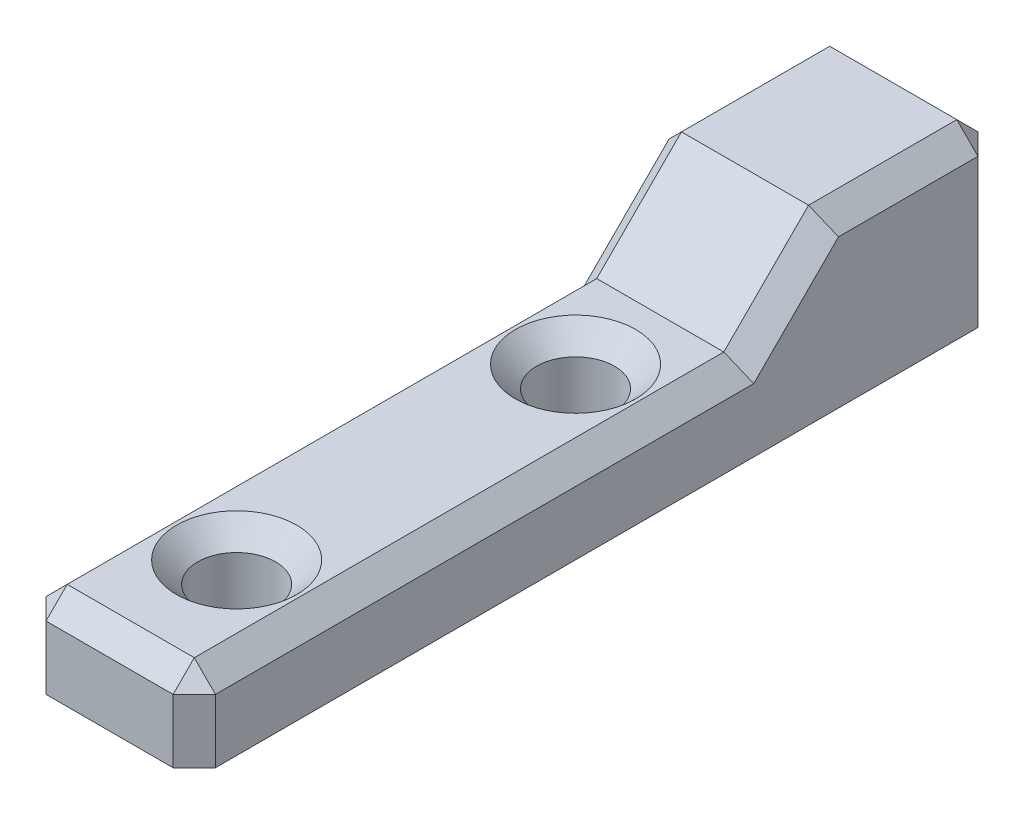
from build123d import *

# Parameters (mm, degrees)
SKETCH1_W           = 12.7
SKETCH1_H           = 60.325
SKETCH1_R           = 2.921
BOSS_EXTRUDE1_DEPTH = 12.7
SKETCH2_W           = 47.625
SKETCH2_H           = 6.35
CUT_EXTRUDE1_DEPTH  = 63.941922635
CHAMFER1_SIZE       = 6.35


# Some blends are built 0.0001 mm under size
with BuildPart() as part:
    # Sketch1 → Boss-Extrude1 (new body)
    with BuildSketch(Plane(origin=(0, 0, 0), x_dir=(1, 0, 0), z_dir=(0, 1, 0))):
        with Locations((6.35, 30.1625)):
            Rectangle(SKETCH1_W, SKETCH1_H)
        with Locations(Location((6.35, 9.525, 0), (0, 0, 270))):
            Circle(SKETCH1_R, mode=Mode.SUBTRACT)
        with Locations(Location((6.35, 34.925, 0), (0, 0, 270))):
            Circle(SKETCH1_R, mode=Mode.SUBTRACT)
    extrude(amount=BOSS_EXTRUDE1_DEPTH)

    # Sketch2 → Cut-Extrude1 (cut, through all)
    with BuildSketch(Plane(origin=(12.7, 0, 0), x_dir=(0, 0, -1), z_dir=(1, 0, 0))):
        with Locations((23.8125, 9.525)):
            Rectangle(SKETCH2_W, SKETCH2_H)
    extrude(amount=-CUT_EXTRUDE1_DEPTH, mode=Mode.SUBTRACT)

    # Chamfer1
    chamfer1_edges = [part.edges().sort_by_distance(p)[0] for p in [
        (6.35, 6.35, -47.625),
    ]]
    chamfer(chamfer1_edges, length=CHAMFER1_SIZE - 0.0001)  # a hair under: the kernel refuses the full size

    # Chamfer2
    # the kernel refuses this chamfer: 1.5875 mm, written as the material it takes off along each edge
    with BuildSketch(Plane(origin=(11.641666667, 11.641666667, -59.266666667), x_dir=(-0.7071067811865476, 0.7071067811865476, 0), z_dir=(0.5773502691896255, 0.5773502691896255, -0.5773502691896263)), Plane(origin=(1.058333333, 5.291666667, -1.058333333), x_dir=(0.7071067811865476, 0.7071067811865476, 0), z_dir=(-0.5773502691896255, 0.5773502691896255, 0.5773502691896261))) as chamfer2_piece_1:
        Polygon((-1.122532015, 0.648094161), (1.122532015, 0.648094161), (0, -1.296188322), align=None)
    extrude(amount=2.016395815, mode=Mode.SUBTRACT)
    with BuildSketch(Plane(origin=(1.058333333, 11.641666667, -59.266666667), x_dir=(0.7071067811865476, 0.7071067811865476, 0), z_dir=(-0.5773502691896255, 0.5773502691896255, -0.5773502691896263)), Plane(origin=(11.641666667, 5.291666667, -1.058333333), x_dir=(-0.7071067811865476, 0.7071067811865476, 0), z_dir=(0.577350269189626, 0.5773502691896254, 0.5773502691896262))) as chamfer2_piece_2:
        Polygon((-1.122532015, -0.648094161), (1.122532015, -0.648094161), (0, 1.296188322), align=None)
    extrude(amount=2.016395815, mode=Mode.SUBTRACT)
    with BuildSketch(Plane(origin=(16.782546743, 12.7, -60.325), x_dir=(0, 0.027495876610586785, 0.9996219169112966), z_dir=(-1, 0, 0)), Plane(origin=(0, 12.7, -64.407546743), x_dir=(0.9996219169112968, 0.02749587661058674, 0), z_dir=(0, 0, 1)), Plane(origin=(0, -4.082546743, -60.325), x_dir=(0.9996219169112968, 0, -0.02749587661058565), z_dir=(0, 1, 0)), Plane(origin=(12.7, -4.082546743, -60.325), x_dir=(0.027495876610586785, 0, 0.9996219169112966), z_dir=(0, 1, 0))) as chamfer2_piece_3:
        with BuildLine():
            Line((1.633018697, 0), (-0.089768608, -1.630549497))
            Line((-0.089768608, -1.630549497), (-0.121506604, -1.629676503))
            ThreePointArc((-0.121506604, -1.629676503), (-0.054180148, -0.815019055), (-0.031737996, 0.000872994))
            Line((-0.031737996, 0.000872994), (0.000872994, 0.031737996))
            ThreePointArc((0.000872994, 0.031737996), (0.816765043, 0.009295844), (1.633891691, 0.031737996))
            Line((1.633891691, 0.031737996), (1.633018697, 0))
        make_face()
    extrude(amount=20.865093487, mode=Mode.SUBTRACT)
    with BuildSketch(Plane(origin=(12.7, 12.7, -43.542453257), x_dir=(0.027495876610586726, -0.9996219169112968, 0), z_dir=(0, 0, -1)), Plane(origin=(16.782546743, 6.35, 0), x_dir=(0, 0.027495876610586223, -0.9996219169112968), z_dir=(-1, 0, 0))) as chamfer2_piece_4:
        with BuildLine():
            Line((1.633018697, 0), (-0.089768608, 1.630549497))
            Line((-0.089768608, 1.630549497), (-0.121506604, 1.629676503))
            ThreePointArc((-0.121506604, 1.629676503), (-0.054180148, 0.815019055), (-0.031737996, -0.000872994))
            Line((-0.031737996, -0.000872994), (0.000872994, -0.031737996))
            ThreePointArc((0.000872994, -0.031737996), (0.816765043, -0.009295844), (1.633891691, -0.031737996))
            Line((1.633891691, -0.031737996), (1.633018697, 0))
        make_face()
    extrude(amount=20.865093487, mode=Mode.SUBTRACT)
    with BuildSketch(Plane(origin=(12.7, -4.082546743, 0), x_dir=(0.027495876610586743, 0, -0.9996219169112966), z_dir=(0, 1, 0)), Plane(origin=(0, -4.082546743, 0), x_dir=(0.9996219169112966, 0, 0.027495876610586355), z_dir=(0, 1, 0))) as chamfer2_piece_5:
        with BuildLine():
            Line((1.633018697, 0), (-0.089768608, 1.630549497))
            Line((-0.089768608, 1.630549497), (-0.121506604, 1.629676503))
            ThreePointArc((-0.121506604, 1.629676503), (-0.054180148, 0.815019055), (-0.031737996, -0.000872994))
            Line((-0.031737996, -0.000872994), (0.000872994, -0.031737996))
            ThreePointArc((0.000872994, -0.031737996), (0.816765043, -0.009295844), (1.633891691, -0.031737996))
            Line((1.633891691, -0.031737996), (1.633018697, 0))
        make_face()
    extrude(amount=14.515093487, mode=Mode.SUBTRACT)
    with BuildSketch(Plane(origin=(6.35, 6.35, -9.525), x_dir=(0, 0, 1), z_dir=(1, 0, 0))) as chamfer2_piece_6:
        with BuildLine():
            Line((4.553401281, -0.044901281), (2.876098719, 1.632401281))
            Line((2.876098719, 1.632401281), (2.844348719, 1.632401281))
            ThreePointArc((2.844348719, 1.632401281), (2.88925, 0.81620064), (2.88925, 0))
            Line((2.88925, 0), (2.921, -0.03175))
            ThreePointArc((2.921, -0.03175), (3.73720064, -0.03175), (4.553401281, -0.076651281))
            Line((4.553401281, -0.076651281), (4.553401281, -0.044901281))
        make_face()
    revolve(axis=Axis((6.35, 6.35, -9.525), (0, -1, 0)), mode=Mode.SUBTRACT)
    with BuildSketch(Plane(origin=(6.35, 6.35, -34.925), x_dir=(0, 0, 1), z_dir=(1, 0, 0))) as chamfer2_piece_7:
        with BuildLine():
            Line((4.553401281, -0.044901281), (2.876098719, 1.632401281))
            Line((2.876098719, 1.632401281), (2.844348719, 1.632401281))
            ThreePointArc((2.844348719, 1.632401281), (2.88925, 0.81620064), (2.88925, 0))
            Line((2.88925, 0), (2.921, -0.03175))
            ThreePointArc((2.921, -0.03175), (3.73720064, -0.03175), (4.553401281, -0.076651281))
            Line((4.553401281, -0.076651281), (4.553401281, -0.044901281))
        make_face()
    revolve(axis=Axis((6.35, 6.35, -34.925), (0, -1, 0)), mode=Mode.SUBTRACT)
    with BuildSketch(Plane(origin=(0, 6.35, -45.357646743), x_dir=(0.9996219169112968, 0.027495876610586195, 0), z_dir=(0, 0, 1))) as chamfer2_piece_8_section:
        with BuildLine():
            Line((1.633018697, 0), (-0.089768608, -1.630549497))
            Line((-0.089768608, -1.630549497), (-0.121506604, -1.629676503))
            ThreePointArc((-0.121506604, -1.629676503), (-0.054180148, -0.815019055), (-0.031737996, 0.000872994))
            Line((-0.031737996, 0.000872994), (0.000872994, 0.031737996))
            ThreePointArc((0.000872994, 0.031737996), (0.816765043, 0.009295844), (1.633891691, 0.031737996))
            Line((1.633891691, 0.031737996), (1.633018697, 0))
        make_face()
    chamfer2_piece_8 = extrude(amount=49.440193487, mode=Mode.PRIVATE)
    chamfer2_piece_8 = split(chamfer2_piece_8, bisect_by=Plane(origin=(0.525455665, -5.379395081, -29.545704919), z_dir=(0, 0.7071067811865474, 0.7071067811865477)), keep=Keep.TOP, mode=Mode.PRIVATE)
    add(chamfer2_piece_8, mode=Mode.SUBTRACT)
    with BuildSketch(Plane(origin=(12.7, 6.35, -45.357646743), x_dir=(0.02749587661058674, -0.9996219169112966, 0), z_dir=(0, 0, 1))) as chamfer2_piece_9_section:
        with BuildLine():
            Line((1.633018697, 0), (-0.089768608, -1.630549497))
            Line((-0.089768608, -1.630549497), (-0.121506604, -1.629676503))
            ThreePointArc((-0.121506604, -1.629676503), (-0.054180148, -0.815019055), (-0.031737996, 0.000872994))
            Line((-0.031737996, 0.000872994), (0.000872994, 0.031737996))
            ThreePointArc((0.000872994, 0.031737996), (0.816765043, 0.009295844), (1.633891691, 0.031737996))
            Line((1.633891691, 0.031737996), (1.633018697, 0))
        make_face()
    chamfer2_piece_9 = extrude(amount=49.440193487, mode=Mode.PRIVATE)
    chamfer2_piece_9 = split(chamfer2_piece_9, bisect_by=Plane(origin=(12.174544335, -5.379395081, -29.545704919), z_dir=(0, 0.7071067811865474, 0.7071067811865477)), keep=Keep.TOP, mode=Mode.PRIVATE)
    add(chamfer2_piece_9, mode=Mode.SUBTRACT)
    with BuildSketch(Plane(origin=(12.7, 3.463203513, -38.388303513), x_dir=(0.027495876610586726, -0.7068394360706733, -0.7068394360706737), z_dir=(0, 0.7071067811865477, -0.7071067811865474))) as chamfer2_piece_10_section:
        with BuildLine():
            Line((1.633018697, 0), (-0.089768608, 1.630549497))
            Line((-0.089768608, 1.630549497), (-0.121506604, 1.629676503))
            ThreePointArc((-0.121506604, 1.629676503), (-0.054180148, 0.815019055), (-0.031737996, -0.000872994))
            Line((-0.031737996, -0.000872994), (0.000872994, -0.031737996))
            ThreePointArc((0.000872994, -0.031737996), (0.816765043, -0.009295844), (1.633891691, -0.031737996))
            Line((1.633891691, -0.031737996), (1.633018697, 0))
        make_face()
    chamfer2_piece_10 = extrude(amount=17.145208187, mode=Mode.PRIVATE)
    chamfer2_piece_10 = split(chamfer2_piece_10, bisect_by=Plane(origin=(12.154882998, 6.35, -44.791724347), z_dir=(0, 1, 0)), keep=Keep.TOP, mode=Mode.PRIVATE)
    add(chamfer2_piece_10, mode=Mode.SUBTRACT)
    with BuildSketch(Plane(origin=(0, 3.463203513, -38.388303513), x_dir=(0.9996219169112968, 0.019442520806014982, 0.019442520806014992), z_dir=(0, 0.7071067811865477, -0.7071067811865474))) as chamfer2_piece_11_section:
        with BuildLine():
            Line((1.633018697, 0), (-0.089768608, 1.630549497))
            Line((-0.089768608, 1.630549497), (-0.121506604, 1.629676503))
            ThreePointArc((-0.121506604, 1.629676503), (-0.054180148, 0.815019055), (-0.031737996, -0.000872994))
            Line((-0.031737996, -0.000872994), (0.000872994, -0.031737996))
            ThreePointArc((0.000872994, -0.031737996), (0.816765043, -0.009295844), (1.633891691, -0.031737996))
            Line((1.633891691, -0.031737996), (1.633018697, 0))
        make_face()
    chamfer2_piece_11 = extrude(amount=17.145208187, mode=Mode.PRIVATE)
    chamfer2_piece_11 = split(chamfer2_piece_11, bisect_by=Plane(origin=(0.545117002, 6.35, -44.791724347), z_dir=(0, 1, 0)), keep=Keep.TOP, mode=Mode.PRIVATE)
    add(chamfer2_piece_11, mode=Mode.SUBTRACT)
    with BuildSketch(Plane(origin=(0, 3.463203513, -38.388303513), x_dir=(0.9996219169112968, 0.019442520806014982, 0.019442520806014992), z_dir=(0, 0.7071067811865477, -0.7071067811865474))) as chamfer2_piece_12a_section:
        with BuildLine():
            Line((1.633018697, 0), (-0.089768608, 1.630549497))
            Line((-0.089768608, 1.630549497), (-0.121506604, 1.629676503))
            ThreePointArc((-0.121506604, 1.629676503), (-0.054180148, 0.815019055), (-0.031737996, -0.000872994))
            Line((-0.031737996, -0.000872994), (0.000872994, -0.031737996))
            ThreePointArc((0.000872994, -0.031737996), (0.816765043, -0.009295844), (1.633891691, -0.031737996))
            Line((1.633891691, -0.031737996), (1.633018697, 0))
        make_face()
    chamfer2_piece_12a = extrude(amount=17.145208187, mode=Mode.PRIVATE)
    chamfer2_piece_12a = split(chamfer2_piece_12a, bisect_by=Plane(origin=(0.504972836, 6.35, -40.423859696), z_dir=(0, -1, 0)), keep=Keep.TOP, mode=Mode.PRIVATE)
    with BuildSketch(Plane(origin=(0, 6.35, -45.357646743), x_dir=(0.9996219169112968, 0.027495876610586195, 0), z_dir=(0, 0, 1))) as chamfer2_piece_12b_section:
        with BuildLine():
            Line((1.633018697, 0), (-0.089768608, -1.630549497))
            Line((-0.089768608, -1.630549497), (-0.121506604, -1.629676503))
            ThreePointArc((-0.121506604, -1.629676503), (-0.054180148, -0.815019055), (-0.031737996, 0.000872994))
            Line((-0.031737996, 0.000872994), (0.000872994, 0.031737996))
            ThreePointArc((0.000872994, 0.031737996), (0.816765043, 0.009295844), (1.633891691, 0.031737996))
            Line((1.633891691, 0.031737996), (1.633018697, 0))
        make_face()
    chamfer2_piece_12b = extrude(amount=49.440193487, mode=Mode.PRIVATE)
    chamfer2_piece_12b = split(chamfer2_piece_12b, bisect_by=Plane(origin=(0.504972836, 6.951917791, -41.877017791), z_dir=(0, -0.7071067811865474, -0.7071067811865477)), keep=Keep.TOP, mode=Mode.PRIVATE)
    chamfer2_piece_12 = chamfer2_piece_12a & chamfer2_piece_12b
    add(chamfer2_piece_12, mode=Mode.SUBTRACT)
    with BuildSketch(Plane(origin=(12.7, 3.463203513, -38.388303513), x_dir=(0.027495876610586726, -0.7068394360706733, -0.7068394360706737), z_dir=(0, 0.7071067811865477, -0.7071067811865474))) as chamfer2_piece_13a_section:
        with BuildLine():
            Line((1.633018697, 0), (-0.089768608, 1.630549497))
            Line((-0.089768608, 1.630549497), (-0.121506604, 1.629676503))
            ThreePointArc((-0.121506604, 1.629676503), (-0.054180148, 0.815019055), (-0.031737996, -0.000872994))
            Line((-0.031737996, -0.000872994), (0.000872994, -0.031737996))
            ThreePointArc((0.000872994, -0.031737996), (0.816765043, -0.009295844), (1.633891691, -0.031737996))
            Line((1.633891691, -0.031737996), (1.633018697, 0))
        make_face()
    chamfer2_piece_13a = extrude(amount=17.145208187, mode=Mode.PRIVATE)
    chamfer2_piece_13a = split(chamfer2_piece_13a, bisect_by=Plane(origin=(12.195027164, 6.35, -40.423859696), z_dir=(0, -1, 0)), keep=Keep.TOP, mode=Mode.PRIVATE)
    with BuildSketch(Plane(origin=(12.7, 6.35, -45.357646743), x_dir=(0.02749587661058674, -0.9996219169112966, 0), z_dir=(0, 0, 1))) as chamfer2_piece_13b_section:
        with BuildLine():
            Line((1.633018697, 0), (-0.089768608, -1.630549497))
            Line((-0.089768608, -1.630549497), (-0.121506604, -1.629676503))
            ThreePointArc((-0.121506604, -1.629676503), (-0.054180148, -0.815019055), (-0.031737996, 0.000872994))
            Line((-0.031737996, 0.000872994), (0.000872994, 0.031737996))
            ThreePointArc((0.000872994, 0.031737996), (0.816765043, 0.009295844), (1.633891691, 0.031737996))
            Line((1.633891691, 0.031737996), (1.633018697, 0))
        make_face()
    chamfer2_piece_13b = extrude(amount=49.440193487, mode=Mode.PRIVATE)
    chamfer2_piece_13b = split(chamfer2_piece_13b, bisect_by=Plane(origin=(12.195027164, 6.951917791, -41.877017791), z_dir=(0, -0.7071067811865474, -0.7071067811865477)), keep=Keep.TOP, mode=Mode.PRIVATE)
    chamfer2_piece_13 = chamfer2_piece_13a & chamfer2_piece_13b
    add(chamfer2_piece_13, mode=Mode.SUBTRACT)


solid = part.part
